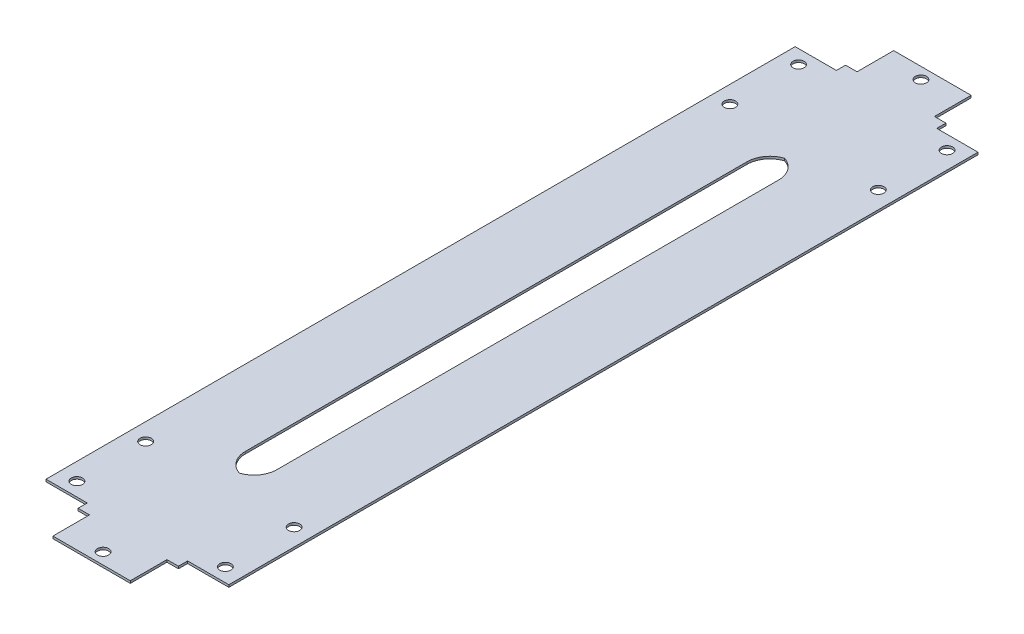
from build123d import *

# Parameters (mm, degrees)
SKETCH1_R           = 2.45
SKETCH1_W           = 13.8
SKETCH1_H           = 239
BOSS_EXTRUDE1_DEPTH = 1
FILLET2_R           = 10


with BuildPart() as part:
    # Sketch1 → Boss-Extrude1 (new body)
    with BuildSketch(Plane(origin=(0, 0, 0), x_dir=(1, 0, 0), z_dir=(0, 1, 0))):
        Polygon((-39.9, -163.5), (-21.9, -163.5), (-21.9, -167.5), (-16.9, -167.5), (-16.9, -183.5), (16.9, -183.5), (16.9, -167.5), (21.9, -167.5), (21.9, -163.5), (39.9, -163.5), (39.9, 163.5), (21.9, 163.5), (21.9, 167.5), (16.9, 167.5), (16.9, 183.5), (-16.9, 183.5), (-16.9, 167.5), (-21.9, 167.5), (-21.9, 163.5), (-39.9, 163.5), align=None)
        with Locations(Location((-32.4, 127.5, 0), (0, 0, 270))):
            Circle(SKETCH1_R, mode=Mode.SUBTRACT)
        with Locations(Location((32.4, 127.5, 0), (0, 0, 270))):
            Circle(SKETCH1_R, mode=Mode.SUBTRACT)
        with Locations(Location((-32.4, -127.5, 0), (0, 0, 270))):
            Circle(SKETCH1_R, mode=Mode.SUBTRACT)
        with Locations(Location((32.4, -127.5, 0), (0, 0, 270))):
            Circle(SKETCH1_R, mode=Mode.SUBTRACT)
        with Locations(Location((-32.4, -157.5, 0), (0, 0, 270))):
            Circle(SKETCH1_R, mode=Mode.SUBTRACT)
        with Locations(Location((32.4, -157.5, 0), (0, 0, 270))):
            Circle(SKETCH1_R, mode=Mode.SUBTRACT)
        with Locations(Location((32.4, 157.5, 0), (0, 0, 270))):
            Circle(SKETCH1_R, mode=Mode.SUBTRACT)
        with Locations(Location((-32.4, 157.5, 0), (0, 0, 270))):
            Circle(SKETCH1_R, mode=Mode.SUBTRACT)
        with Locations(Location((0, 178.5, 0), (0, 0, 270))):
            Circle(SKETCH1_R, mode=Mode.SUBTRACT)
        with Locations(Location((0, -178.5, 0), (0, 0, 270))):
            Circle(SKETCH1_R, mode=Mode.SUBTRACT)
        Rectangle(SKETCH1_W, SKETCH1_H, mode=Mode.SUBTRACT)
    extrude(amount=BOSS_EXTRUDE1_DEPTH)

    # Fillet2
    # the kernel refuses this fillet: 10 mm, written as the material it adds along each edge
    with BuildSketch(Plane(origin=(6.9, 0, -119.5), x_dir=(-1, 0, 0), z_dir=(0, 1, 0)), Plane(origin=(6.9, 0, 119.5), x_dir=(0, 0, -1), z_dir=(0, 1, 0)), Plane(origin=(-6.9, 0, 119.5), x_dir=(1, 0, 0), z_dir=(0, 1, 0))) as fillet2_piece_1:
        with BuildLine():
            CenterArc((FILLET2_R, FILLET2_R), FILLET2_R, 180, 90)
            Line((0, FILLET2_R), (0, 0))
            Line((0, 0), (FILLET2_R, 0))
        make_face()
    extrude(amount=1)
    with BuildSketch(Plane(origin=(-6.9, 0, -119.5), x_dir=(1, 0, 0), z_dir=(0, 1, 0))) as fillet2_piece_2:
        with BuildLine():
            CenterArc((FILLET2_R, -FILLET2_R), FILLET2_R, 90, 90)
            Line((0, -FILLET2_R), (0, 0))
            Line((0, 0), (FILLET2_R, 0))
        make_face()
    extrude(amount=1)


solid = part.part
